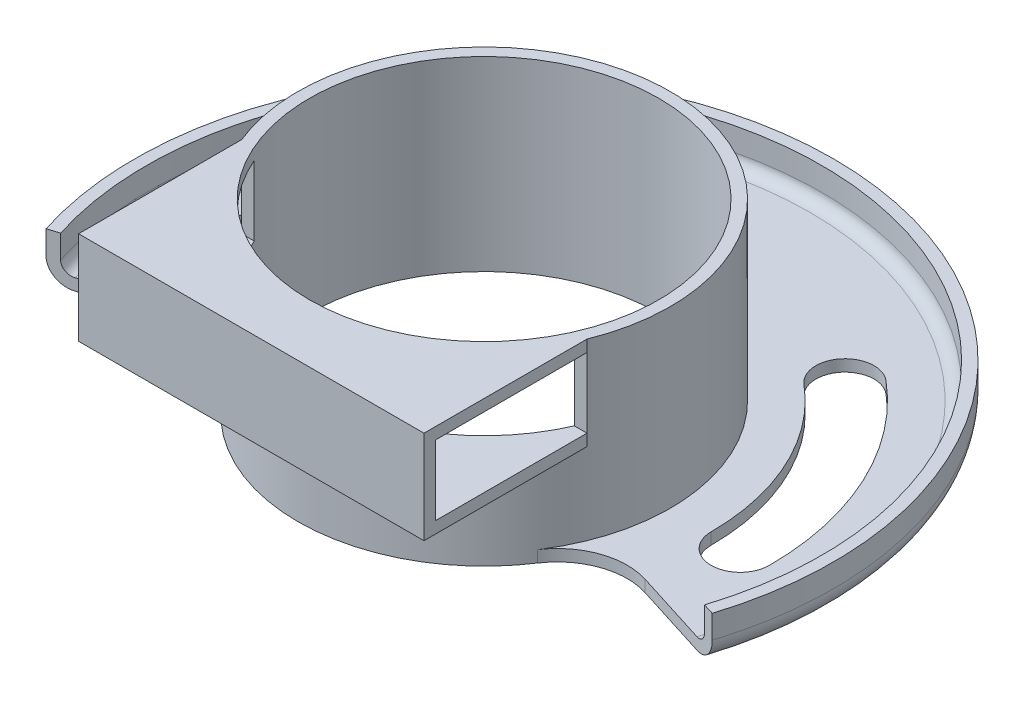
from build123d import *

# Parameters (mm, degrees)
SKETCH_1_R               = 30
SKETCH_1_R_2             = 16
EXTRUDE_1_DEPTH          = 4
FILLET_1_R               = 2
SHELL_12_T               = -1
EXTRUDE_7_DEPTH          = 16
CUT_EXTRUDE_START        = -4
SKETCH_7_R               = 16
CUT_EXTRUDE_5_DEPTH      = 4
CUT_EXTRUDE_6_DEPTH      = 1
SHELL_15_T               = -1
SKETCH_9_W               = 29.664793948
SKETCH_9_H               = 14
EXTRUDE_8_DEPTH          = 8
SHELL_START              = 6
SHELL_16_OUTLINE_W       = 29.664793948
SHELL_16_OUTLINE_H       = 6
SHELL_16_DEPTH           = 13
CUT_EXTRUDE_9_DEPTH      = 46.000000133
CUT_EXTRUDE_9_DEPTH_BACK = 46.000000133
SKETCH_10_R              = 15


# Read off the part's stored shape, not the designer's step: 抽壳16
with BuildPart() as part:
    # 草图1 → 凸台-拉伸1 (new body)
    with BuildSketch(Plane(origin=(0, 0, 0), x_dir=(1, 0, 0), z_dir=(0, 1, 0))):
        with Locations(Location((0, 0, 0), (0, 0, 270))):
            Circle(SKETCH_1_R)
        with Locations(Location((0, 0, 0), (0, 0, 270))):
            Circle(SKETCH_1_R_2, mode=Mode.SUBTRACT)
    extrude(amount=EXTRUDE_1_DEPTH)

    # 圆角1
    fillet_1_edges = [part.edges().sort_by_distance(p)[0] for p in [
        (0, 0, -30),
    ]]
    fillet(fillet_1_edges, radius=FILLET_1_R)

    # 抽壳12
    shell_12_openings = [part.faces().sort_by_distance(p)[0] for p in [
        (0, 4, -29.151471863),
        (0, 2, -16),
    ]]
    offset(amount=SHELL_12_T, openings=shell_12_openings, kind=Kind.INTERSECTION)

    # 草图7 → 切除-拉伸5 (cut)
    with BuildSketch(Plane(origin=(0, 4, 0), x_dir=(1, 0, 0), z_dir=(0, 1, 0)).offset(CUT_EXTRUDE_START)):
        with Locations(Location((0, 0, 0), (0, 0, 270))):
            Circle(SKETCH_7_R)
        with BuildLine():
            Line((-28.611508522, -9.021173985), (-20.186382983, -6.364742106))
            ThreePointArc((-20.186382983, -6.364742106), (-16.370751886, -6.434231685), (-13.368835044, -8.790577317))
            ThreePointArc((-13.368835044, -8.790577317), (0, -16), (13.368835044, -8.790577317))
            ThreePointArc((13.368835044, -8.790577317), (16.370751886, -6.434231685), (20.186382983, -6.364742106))
            Line((20.186382983, -6.364742106), (28.611508522, -9.021173985))
            ThreePointArc((28.611508522, -9.021173985), (0, -30), (-28.611508522, -9.021173985))
        make_face()
    extrude(amount=CUT_EXTRUDE_5_DEPTH, mode=Mode.SUBTRACT)

    # 草图8 → 切除-拉伸6 (cut)
    with BuildSketch(Plane(origin=(0, 1, 0), x_dir=(1, 0, 0), z_dir=(0, 1, 0))):
        with BuildLine():
            ThreePointArc((-15.748296437, 18.768088856), (-22.204540782, 10.354147413), (-24.5, 0))
            ThreePointArc((-24.5, 0), (-22, -2.5), (-19.5, 0))
            ThreePointArc((-19.5, 0), (-17.673001847, 8.241056104), (-12.534358389, 14.937866641))
            ThreePointArc((-12.534358389, 14.937866641), (-12.226216305, 18.459946773), (-15.748296437, 18.768088856))
        make_face()
        with BuildLine():
            ThreePointArc((15.748296437, 18.768088856), (22.204540782, 10.354147413), (24.5, 0))
            ThreePointArc((24.5, 0), (22, -2.5), (19.5, 0))
            ThreePointArc((19.5, 0), (17.673001847, 8.241056104), (12.534358389, 14.937866641))
            ThreePointArc((12.534358389, 14.937866641), (12.226216305, 18.459946773), (15.748296437, 18.768088856))
        make_face()
    extrude(amount=-CUT_EXTRUDE_6_DEPTH, mode=Mode.SUBTRACT)


with BuildPart() as body_2:
    # 草图1<8> → 凸台-拉伸7 (new body)
    with BuildSketch(Plane(origin=(0, 0, 0), x_dir=(1, 0, 0), z_dir=(0, 1, 0))):
        with BuildLine():
            ThreePointArc((16, 0), (11.313708499, 11.313708499), (0, 16))
            Line((0, 16), (0, -16))
            ThreePointArc((0, -16), (11.313708499, -11.313708499), (16, 0))
        make_face()
        with BuildLine():
            Line((0, -16), (0, 16))
            ThreePointArc((0, 16), (-16, 0), (0, -16))
        make_face()
    extrude(amount=EXTRUDE_7_DEPTH)

    # 抽壳15
    shell_15_openings = [body_2.faces().sort_by_distance(p)[0] for p in [
        (0, 16, 0),
    ]]
    offset(amount=SHELL_15_T, openings=shell_15_openings, kind=Kind.INTERSECTION)

    # 草图9 → 凸台-拉伸8 (add)
    with BuildSketch(Plane(origin=(0, 16, 0), x_dir=(1, 0, 0), z_dir=(0, 1, 0))):
        with Locations((0, -13)):
            Rectangle(SKETCH_9_W, SKETCH_9_H)
    extrude(amount=-EXTRUDE_8_DEPTH)

    # 抽壳16 outline → 抽壳16 (cut)
    with BuildSketch(Plane.XY.offset(SHELL_START)):
        with Locations((0, 12)):
            Rectangle(SHELL_16_OUTLINE_W, SHELL_16_OUTLINE_H)
    extrude(amount=SHELL_16_DEPTH, mode=Mode.SUBTRACT)

    # 草图10 → 切除-拉伸9 (cut, two sides: drawn at the far end of the back side and taken through both)
    with BuildSketch(Plane(origin=(0, 1, 0), x_dir=(1, 0, 0), z_dir=(0, 1, 0)).offset(-CUT_EXTRUDE_9_DEPTH_BACK)):
        with Locations(Location((0, 0, 0), (0, 0, 270))):
            Circle(SKETCH_10_R)
    extrude(amount=CUT_EXTRUDE_9_DEPTH + CUT_EXTRUDE_9_DEPTH_BACK, mode=Mode.SUBTRACT)


solid = Compound([part.part, body_2.part])
